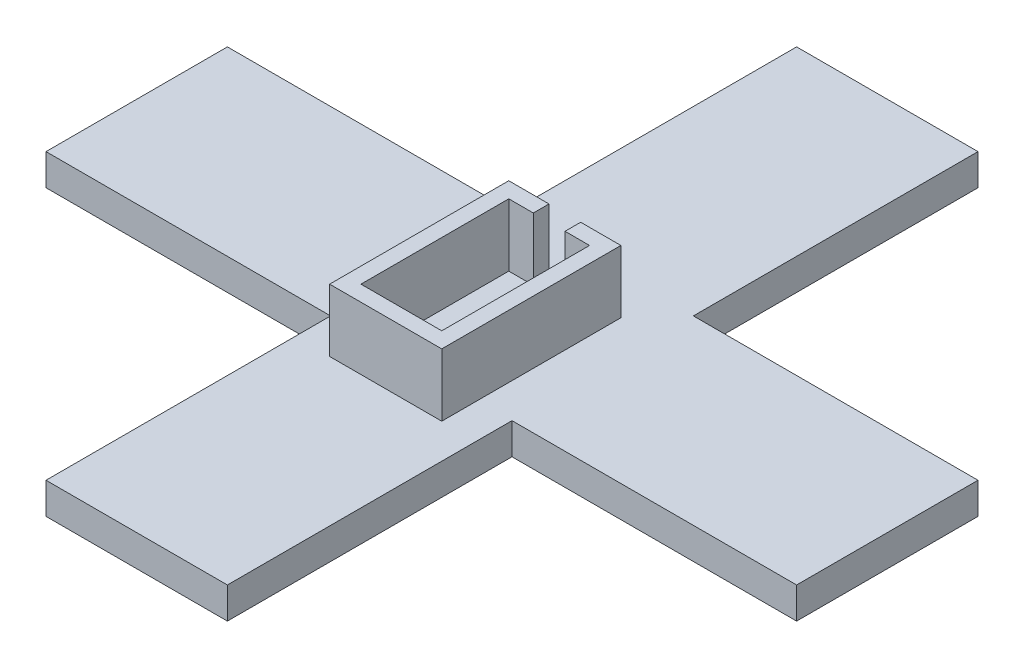
from build123d import *

# Parameters (mm, degrees)
BOSS_EXTRUDE18_DEPTH = 5
BOSS_EXTRUDE19_DEPTH = 10


with BuildPart() as part:
    # Sketch21 → Boss-Extrude18 (new body)
    with BuildSketch(Plane(origin=(0, 0, 0), x_dir=(1, 0, 0), z_dir=(0, 1, 0))):
        Polygon((0, 59.92), (-14.48, 59.92), (-14.48, 14.48), (-59.92, 14.48), (-59.92, 0), (-59.92, -14.48), (-14.48, -14.48), (-14.48, -59.92), (0, -59.92), (14.48, -59.92), (14.48, -14.48), (59.92, -14.48), (59.92, 0), (59.92, 14.48), (14.48, 14.48), (14.48, 59.92), align=None)
    extrude(amount=BOSS_EXTRUDE18_DEPTH)

    # Sketch23 → Boss-Extrude19 (add)
    with BuildSketch(Plane(origin=(0, 5, 0), x_dir=(1, 0, 0), z_dir=(0, 1, 0))):
        Polygon((-8.95, 8.435), (-2.53, 8.435), (-2.53, 5.935), (-6.45, 5.935), (-6.45, -17.665), (6.45, -17.665), (6.45, 5.935), (2.53, 5.935), (2.53, 8.435), (8.95, 8.435), (8.95, -20.165), (-8.95, -20.165), align=None)
    extrude(amount=BOSS_EXTRUDE19_DEPTH)


solid = part.part
